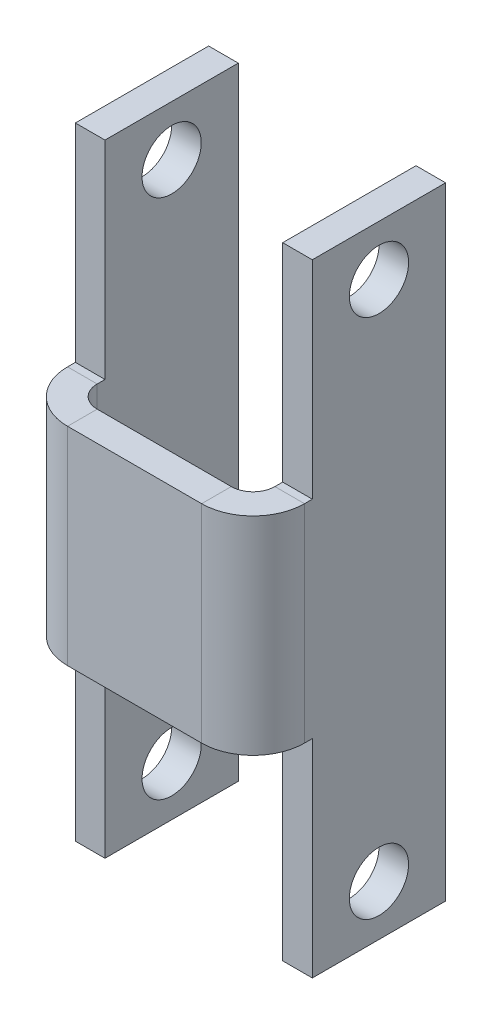
from build123d import *

# Parameters (mm, degrees)
CROQUIS1_W                         = 8
CROQUIS1_H                         = 21
BRIDA_BASE1_DEPTH                  = 1
BRIDA_DE_ARISTA1_STRIP_W           = 5.4732
BRIDA_DE_ARISTA1_STRIP_H           = 1
BRIDA_DE_ARISTA1_STRIP_CUT_DEPTH   = 21
BRIDA_DE_ARISTA1_STRIP_2_W         = 5.4732
BRIDA_DE_ARISTA1_STRIP_2_H         = 1
BRIDA_DE_ARISTA1_STRIP_CUT_2_DEPTH = 21
BRIDA_DE_ARISTA1_DEPTH             = 21
BRIDA_DE_ARISTA1_BEND_DEPTH        = 21
CROQUIS34_W                        = 2
CROQUIS34_H                        = 7
CORTAR_EXTRUIR1_DEPTH              = 10
CORTAR_EXTRUIR2_REACH              = 16.714
CROQUIS35_R                        = 1


# Sheet-metal steps are written as plain solids
with BuildPart() as part:
    # Croquis1 → Brida base1 (new body)
    with BuildSketch(Plane.XY):
        Rectangle(CROQUIS1_W, CROQUIS1_H)
    extrude(amount=-BRIDA_BASE1_DEPTH)

    # Brida de arista1 strip (across the edge) → Brida de arista1 strip cut (cut)
    with BuildSketch(Plane(origin=(-4, -10.5, -1), x_dir=(1, 0, 0), z_dir=(0, 1, 0))):
        with Locations((-1, -0.5)):
            Rectangle(BRIDA_DE_ARISTA1_STRIP_W, BRIDA_DE_ARISTA1_STRIP_H)
    extrude(amount=BRIDA_DE_ARISTA1_STRIP_CUT_DEPTH, mode=Mode.SUBTRACT)

    # Brida de arista1 strip 2 (across the edge) → Brida de arista1 strip cut 2 (cut)
    with BuildSketch(Plane(origin=(4, 10.5, -1), x_dir=(-1, 0, 0), z_dir=(0, -1, 0))):
        with Locations((-1, -0.5)):
            Rectangle(BRIDA_DE_ARISTA1_STRIP_2_W, BRIDA_DE_ARISTA1_STRIP_2_H)
    extrude(amount=BRIDA_DE_ARISTA1_STRIP_CUT_2_DEPTH, mode=Mode.SUBTRACT)

    # Brida de arista1 section (across the edge) → Brida de arista1 (add)
    with BuildSketch(Plane(origin=(-4, -10.5, -1), x_dir=(1, 0, 0), z_dir=(0, 1, 0))):
        with BuildLine():
            Line((0, 0.7366), (0, 5.5))
            Line((0, 5.5), (1, 5.5))
            Line((1, 5.5), (1, 0.7366))
            ThreePointArc((1, 0.7366), (1.215745145, 0.215745145), (1.7366, 0))
            Line((1.7366, 0), (1.7366, -1))
            ThreePointArc((1.7366, -1), (0.508638364, -0.491361636), (0, 0.7366))
        make_face()
    extrude(amount=BRIDA_DE_ARISTA1_DEPTH)

    # Brida de arista1 section 2 (across the edge) → Brida de arista1 bend (add)
    with BuildSketch(Plane(origin=(4, 10.5, -1), x_dir=(-1, 0, 0), z_dir=(0, -1, 0))):
        with BuildLine():
            Line((0, 0.7366), (0, 5.5))
            Line((0, 5.5), (1, 5.5))
            Line((1, 5.5), (1, 0.7366))
            ThreePointArc((1, 0.7366), (1.215745145, 0.215745145), (1.7366, 0))
            Line((1.7366, 0), (1.7366, -1))
            ThreePointArc((1.7366, -1), (0.508638364, -0.491361636), (0, 0.7366))
        make_face()
    extrude(amount=BRIDA_DE_ARISTA1_BEND_DEPTH)

    # Croquis34 → Cortar-Extruir1 (cut)
    with BuildSketch(Plane(origin=(4, 0, 0), x_dir=(0, 0, -1), z_dir=(1, 0, 0))):
        with Locations((1, 7)):
            Rectangle(CROQUIS34_W, CROQUIS34_H)
        with Locations((1, -7)):
            Rectangle(CROQUIS34_W, CROQUIS34_H)
    extrude(amount=-CORTAR_EXTRUIR1_DEPTH, mode=Mode.SUBTRACT)

    # Cortar-Extruir2: up to this face of the body (flat: up to its plane)
    cortar_extruir2_end = Plane(part.part.faces().sort_by_distance((-4, 0, -4.204419709))[0])
    # Croquis35 → Cortar-Extruir2 (cut, up to the picked face)
    with BuildSketch(Plane(origin=(4, 0, 0), x_dir=(0, 0, -1), z_dir=(1, 0, 0)), mode=Mode.PRIVATE) as cortar_extruir2_sk1:
        with Locations((4.25, 8.8)):
            Circle(CROQUIS35_R)
    cortar_extruir2_tool1 = split(extrude(cortar_extruir2_sk1.sketch, amount=-CORTAR_EXTRUIR2_REACH, mode=Mode.PRIVATE), bisect_by=cortar_extruir2_end, keep=Keep.BOTH, mode=Mode.PRIVATE)
    # Croquis35 → Cortar-Extruir2 (cut, up to the picked face)
    with BuildSketch(Plane(origin=(4, 0, 0), x_dir=(0, 0, -1), z_dir=(1, 0, 0)), mode=Mode.PRIVATE) as cortar_extruir2_sk2:
        with Locations(Location((4.25, -8.8, 0), (0, 0, 180))):
            Circle(CROQUIS35_R)
    cortar_extruir2_tool2 = split(extrude(cortar_extruir2_sk2.sketch, amount=-CORTAR_EXTRUIR2_REACH, mode=Mode.PRIVATE), bisect_by=cortar_extruir2_end, keep=Keep.BOTH, mode=Mode.PRIVATE)
    add(cortar_extruir2_tool1.solids().sort_by(Axis((4, 8.8, -4.25), (-1, 0, 0)))[0], mode=Mode.SUBTRACT)
    add(cortar_extruir2_tool2.solids().sort_by(Axis((4, -8.8, -4.25), (-1, 0, 0)))[0], mode=Mode.SUBTRACT)


solid = part.part
